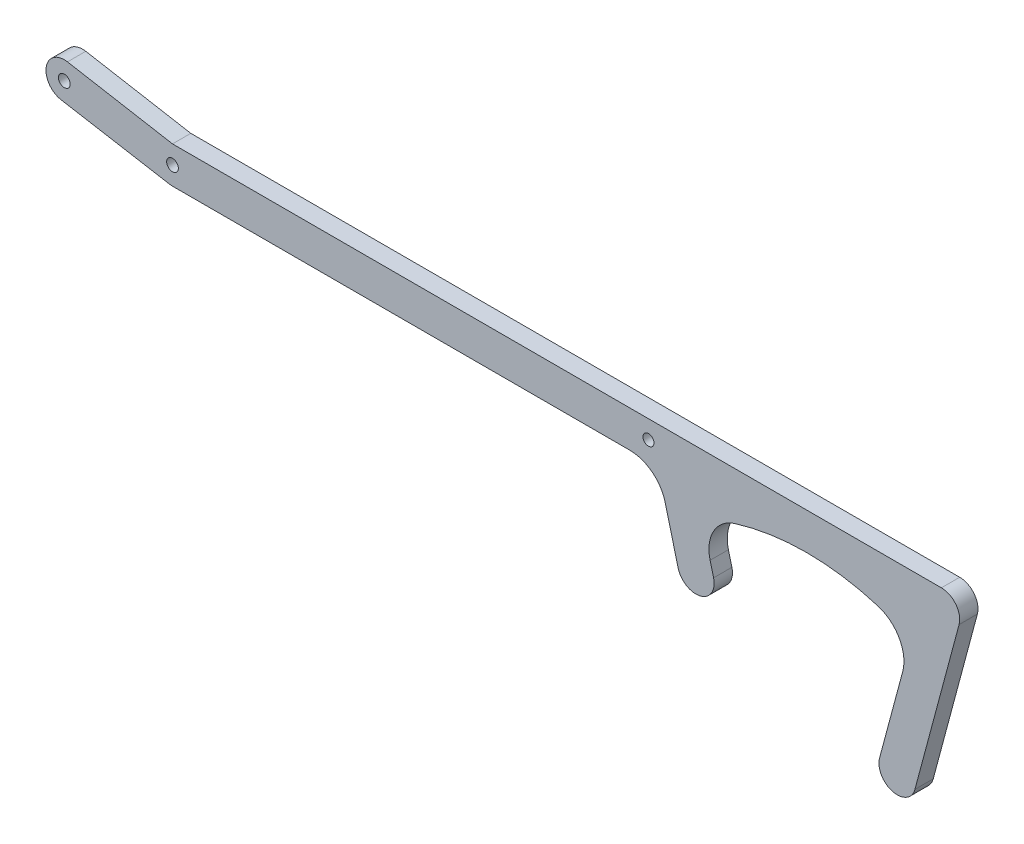
from build123d import *

# Parameters (mm, degrees)
SKETCH1_R           = 2.032
SKETCH1_R_2         = 1.905
BOSS_EXTRUDE1_DEPTH = 3.175
FILLET1_R           = 12.7
FILLET2_R           = 12.7


with BuildPart() as part:
    # Sketch1 → Boss-Extrude1 (new, symmetric)
    with BuildSketch(Plane.XY):
        with BuildLine():
            Line((0, 6.35), (266.7, 6.35))
            ThreePointArc((266.7, 6.35), (271.737793711, 3.865635074), (272.833628997, -1.643500936))
            Line((272.833628997, -1.643500936), (257.520332649, -58.793500936))
            ThreePointArc((257.520332649, -58.793500936), (249.743202716, -63.283628997), (245.253074656, -55.506499064))
            Line((245.253074656, -55.506499064), (256.212598299, -14.605))
            ThreePointArc((256.212598299, -14.605), (219.940366893, -6.419077966), (183.668135487, -14.605))
            Line((183.668135487, -14.605), (187.685064715, -30.1625))
            ThreePointArc((187.685064715, -30.1625), (183.124203653, -37.898361062), (175.38834259, -33.3375))
            Line((175.38834259, -33.3375), (168.420200053, -6.35))
            Line((168.420200053, -6.35), (0, -6.35))
            ThreePointArc((0, -6.35), (-0.545429878, -6.326531929), (-1.0868282, -6.256301181))
            Line((-1.0868282, -6.256301181), (-38.624635284, 0.264668019))
            ThreePointArc((-38.624635284, 0.264668019), (-43.792727303, 7.615717142), (-36.435141156, 12.774498432))
            Line((-36.435141156, 12.774498432), (0, 6.35))
        make_face()
        Circle(SKETCH1_R, mode=Mode.SUBTRACT)
        with Locations((165.1, 0)):
            Circle(SKETCH1_R_2, mode=Mode.SUBTRACT)
        with Locations((-37.537807084, 6.5209692)):
            Circle(SKETCH1_R, mode=Mode.SUBTRACT)
    extrude(amount=BOSS_EXTRUDE1_DEPTH, both=True)

    # Fillet1
    fillet1_edges = [part.edges().sort_by_distance(p)[0] for p in [
        (168.420200053, -6.35, 0),
    ]]
    fillet(fillet1_edges, radius=FILLET1_R)

    # Fillet2
    fillet2_edges = [part.edges().sort_by_distance(p)[0] for p in [
        (256.212598299, -14.605, 0),
        (183.668135487, -14.605, 0),
    ]]
    fillet(fillet2_edges, radius=FILLET2_R)


solid = part.part
